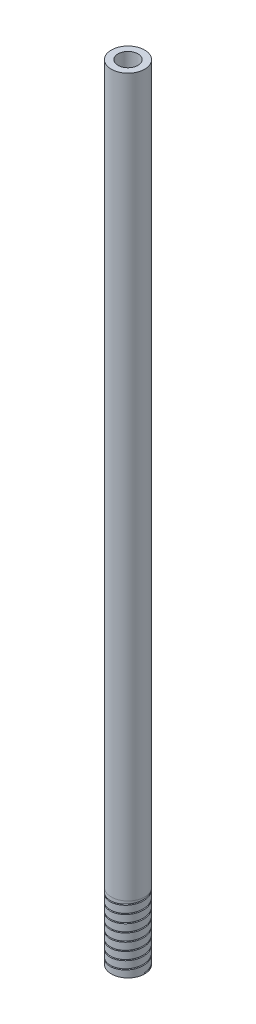
from build123d import *
from build123d.topology import SkipClean

# Parameters (mm, degrees)
SKETCH1_R           = 25
BOSS_EXTRUDE1_DEPTH = 100
SKETCH2_R           = 25
BOSS_EXTRUDE2_DEPTH = 1075
THREAD1_PITCH       = 12
SKETCH5_R           = 15
CUT_EXTRUDE1_DEPTH  = 75


with BuildPart() as part:
    # Sketch1 → Boss-Extrude1 (new body)
    with BuildSketch(Plane(origin=(0, 0, 0), x_dir=(1, 0, 0), z_dir=(0, 1, 0))):
        with Locations(Location((0, 0, 0), (0, 0, 270))):
            Circle(SKETCH1_R)
    extrude(amount=BOSS_EXTRUDE1_DEPTH)

    # Thread1: the profile of Thread Profile1 profile screwed along a right-hand helix of 8.333333 turns, 16 arcs to a turn; built about Z, then put on its axis
    with SkipClean():  # the faces are left unmerged after this step: merging them gives an invalid solid
        thread1_z = Axis((0, 0, 0), (0, 0, 1))
        thread1_corners = [(25.0003, 0, -0.000173205), (25.0003, 0, 1.7501732), (23.91746825, 0, 1.124999997), (23.91746825, 0, 0.624999997)]
        with BuildLine(mode=Mode.PRIVATE) as thread1_profile:
            Line(thread1_corners[0], thread1_corners[1])
            Line(thread1_corners[1], thread1_corners[2])
            Line(thread1_corners[2], thread1_corners[3])
            Line(thread1_corners[3], thread1_corners[0])
        thread1_cap = Face(thread1_profile.wire())
        thread1_turn_angles = [0, 11.25, 22.5, 33.75, 45, 56.25, 67.5, 78.75, 90, 101.25, 112.5, 123.75, 135, 146.25, 157.5, 168.75, 180, 191.25, 202.5, 213.75, 225, 236.25, 247.5, 258.75, 270, 281.25, 292.5, 303.75, 315, 326.25, 337.5, 348.75, 360]
        thread1_turn_weights = [1, 0.9807852804032304, 1, 0.9807852804032304, 1, 0.9807852804032304, 1, 0.9807852804032304, 1, 0.9807852804032304, 1, 0.9807852804032304, 1, 0.9807852804032304, 1, 0.9807852804032304, 1, 0.9807852804032304, 1, 0.9807852804032304, 1, 0.9807852804032304, 1, 0.9807852804032304, 1, 0.9807852804032304, 1, 0.9807852804032304, 1, 0.9807852804032304, 1, 0.9807852804032304, 1]
        thread1_turn_rails = [Edge.make_bspline([Vector(p[0], p[1], 0).rotate(thread1_z, thread1_turn_angles[k]) / thread1_turn_weights[k] + Vector(0, 0, p[2] + THREAD1_PITCH * thread1_turn_angles[k] / 360) for k in range(33)], [0, 0, 0, 1, 1, 2, 2, 3, 3, 4, 4, 5, 5, 6, 6, 7, 7, 8, 8, 9, 9, 10, 10, 11, 11, 12, 12, 13, 13, 14, 14, 15, 15, 16, 16, 16], 2, thread1_turn_weights) for p in thread1_corners]
        thread1_turn_sides = [Face.make_surface_from_curves(thread1_turn_rails[p[0]], thread1_turn_rails[p[1]]) for p in [(0, 1), (1, 2), (2, 3), (3, 0)]]
        thread1_last_angles = [2880, 2891.25, 2902.5, 2913.75, 2925, 2936.25, 2947.5, 2958.75, 2970, 2981.25, 2992.5, 2996.25, 3000]
        thread1_last_weights = [1, 0.9807852804032304, 1, 0.9807852804032304, 1, 0.9807852804032304, 1, 0.9807852804032304, 1, 0.9807852804032304, 1, 0.9978589232386035, 1]
        thread1_last_rails = [Edge.make_bspline([Vector(p[0], p[1], 0).rotate(thread1_z, thread1_last_angles[k]) / thread1_last_weights[k] + Vector(0, 0, p[2] + THREAD1_PITCH * thread1_last_angles[k] / 360) for k in range(13)], [0, 0, 0, 1, 1, 2, 2, 3, 3, 4, 4, 5, 5, 6, 6, 6], 2, thread1_last_weights) for p in thread1_corners]
        thread1_last_sides = [Face.make_surface_from_curves(thread1_last_rails[p[0]], thread1_last_rails[p[1]]) for p in [(0, 1), (1, 2), (2, 3), (3, 0)]]
        thread1 = Plane(origin=(0, 0, 0), x_dir=(1, 0, 0), z_dir=(0, 1, 0)) * Solid(Shell([*[p.moved(Location((0, 0, THREAD1_PITCH * i))) for i in range(8) for p in thread1_turn_sides], *thread1_last_sides, thread1_cap, thread1_cap.rotate(thread1_z, 3000).moved(Location((0, 0, THREAD1_PITCH * 3000 / 360)))]))
        add(thread1, mode=Mode.SUBTRACT)


with BuildPart() as body_2:
    # Sketch2 → Boss-Extrude2 (new body)
    with BuildSketch(Plane(origin=(0, 100, 0), x_dir=(1, 0, 0), z_dir=(0, 1, 0))):
        with Locations(Location((0, 0, 0), (0, 0, 270))):
            Circle(SKETCH2_R)
    extrude(amount=BOSS_EXTRUDE2_DEPTH)

    # Sketch5 → Cut-Extrude1 (cut)
    with BuildSketch(Plane(origin=(0, 1175, 0), x_dir=(1, 0, 0), z_dir=(0, 1, 0))):
        with Locations(Location((0, 0, 0), (0, 0, 270))):
            Circle(SKETCH5_R)
    extrude(amount=-CUT_EXTRUDE1_DEPTH, mode=Mode.SUBTRACT)


solid = Compound([part.part, body_2.part])
